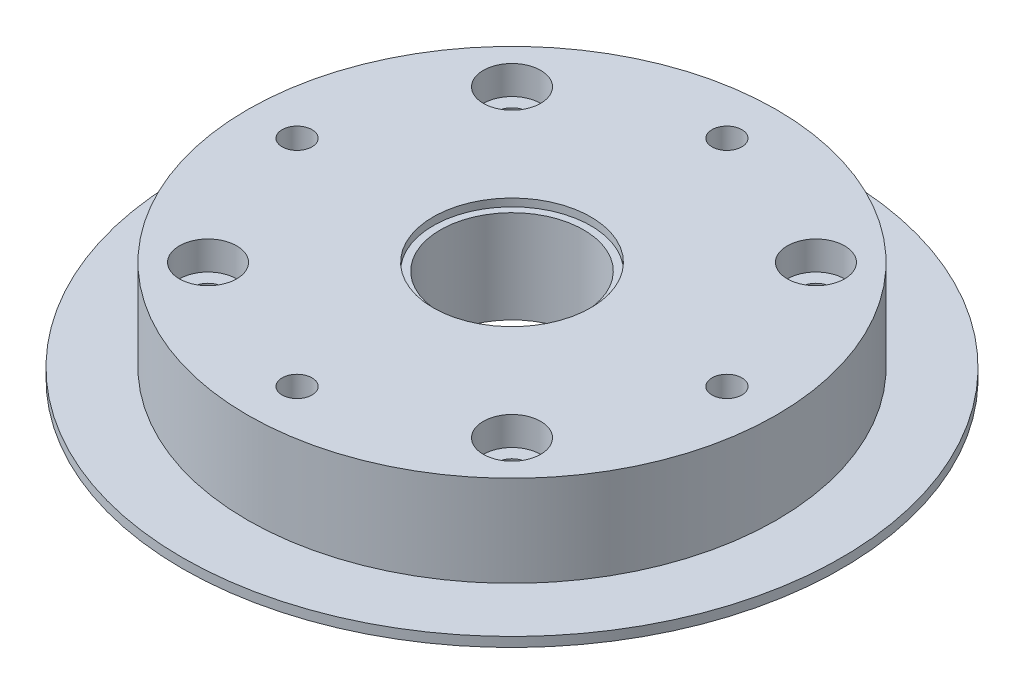
from build123d import *

# Parameters (mm, degrees)
SKETCH1_R           = 34.5
SKETCH1_R_2         = 1.5635
SKETCH1_R_3         = 7.5
BOSS_EXTRUDE1_DEPTH = 1
BOSS_EXTRUDE2_START = 9.525
SKETCH1_3_R         = 27.69
SKETCH1_3_R_2       = 7.5
SKETCH1_3_R_3       = 1.5635
BOSS_EXTRUDE2_DEPTH = 9.525
SKETCH2_R           = 3
SKETCH2_R_2         = 1.5635
CUT_EXTRUDE1_DEPTH  = 3
SKETCH3_R           = 1.925
CUT_EXTRUDE2_DEPTH  = 4
CUT_EXTRUDE3_START  = 9.525
SKETCH1_6_R         = 8.25
SKETCH1_6_R_2       = 7.5
CUT_EXTRUDE3_DEPTH  = 0.8


with BuildPart() as part:
    # Sketch1 → Boss-Extrude1 (new body)
    with BuildSketch(Plane(origin=(0, 0, 0), x_dir=(1, 0, 0), z_dir=(0, 1, 0))):
        Circle(SKETCH1_R)
        with Locations((22.5, 0)):
            Circle(SKETCH1_R_2, mode=Mode.SUBTRACT)
        with Locations((-15.909902577, -15.909902577)):
            Circle(SKETCH1_R_2, mode=Mode.SUBTRACT)
        with Locations((0, -22.5)):
            Circle(SKETCH1_R_2, mode=Mode.SUBTRACT)
        with Locations((15.909902577, -15.909902577)):
            Circle(SKETCH1_R_2, mode=Mode.SUBTRACT)
        with Locations((-22.5, 0)):
            Circle(SKETCH1_R_2, mode=Mode.SUBTRACT)
        with Locations((-15.909902577, 15.909902577)):
            Circle(SKETCH1_R_2, mode=Mode.SUBTRACT)
        with Locations((0, 22.5)):
            Circle(SKETCH1_R_2, mode=Mode.SUBTRACT)
        with Locations((15.909902577, 15.909902577)):
            Circle(SKETCH1_R_2, mode=Mode.SUBTRACT)
        Circle(SKETCH1_R_3, mode=Mode.SUBTRACT)
    extrude(amount=-BOSS_EXTRUDE1_DEPTH)

    # Sketch1<3> → Boss-Extrude2 (add)
    with BuildSketch(Plane(origin=(0, 0, 0), x_dir=(1, 0, 0), z_dir=(0, 1, 0)).offset(BOSS_EXTRUDE2_START)):
        Circle(SKETCH1_3_R)
        Circle(SKETCH1_3_R_2, mode=Mode.SUBTRACT)
        with Locations((-15.909902577, -15.909902577)):
            Circle(SKETCH1_3_R_3, mode=Mode.SUBTRACT)
        with Locations((0, -22.5)):
            Circle(SKETCH1_3_R_3, mode=Mode.SUBTRACT)
        with Locations((15.909902577, -15.909902577)):
            Circle(SKETCH1_3_R_3, mode=Mode.SUBTRACT)
        with Locations((-22.5, 0)):
            Circle(SKETCH1_3_R_3, mode=Mode.SUBTRACT)
        with Locations((-15.909902577, 15.909902577)):
            Circle(SKETCH1_3_R_3, mode=Mode.SUBTRACT)
        with Locations((0, 22.5)):
            Circle(SKETCH1_3_R_3, mode=Mode.SUBTRACT)
        with Locations((22.5, 0)):
            Circle(SKETCH1_3_R_3, mode=Mode.SUBTRACT)
        with Locations((15.909902577, 15.909902577)):
            Circle(SKETCH1_3_R_3, mode=Mode.SUBTRACT)
    extrude(amount=-BOSS_EXTRUDE2_DEPTH)

    # Sketch2 → Cut-Extrude1 (cut)
    # profile 1 of 4: a face of its own
    with BuildSketch(Plane(origin=(0, 9.525, 0), x_dir=(1, 0, 0), z_dir=(0, 1, 0))):
        with Locations((15.909902577, 15.909902577)):
            Circle(SKETCH2_R)
        with Locations((15.909902577, 15.909902577)):
            Circle(SKETCH2_R_2, mode=Mode.SUBTRACT)
    # profile 2 of 4: a face of its own
    with BuildSketch(Plane(origin=(0, 9.525, 0), x_dir=(1, 0, 0), z_dir=(0, 1, 0))):
        with Locations((15.909902577, -15.909902577)):
            Circle(SKETCH2_R)
    # profile 3 of 4: a face of its own
    with BuildSketch(Plane(origin=(0, 9.525, 0), x_dir=(1, 0, 0), z_dir=(0, 1, 0))):
        with Locations((-15.909902577, -15.909902577)):
            Circle(SKETCH2_R)
        with Locations((-15.909902577, -15.909902577)):
            Circle(SKETCH2_R_2, mode=Mode.SUBTRACT)
    # profile 4 of 4: a face of its own
    with BuildSketch(Plane(origin=(0, 9.525, 0), x_dir=(1, 0, 0), z_dir=(0, 1, 0))):
        with Locations((-15.909902577, 15.909902577)):
            Circle(SKETCH2_R)
        with Locations((-15.909902577, 15.909902577)):
            Circle(SKETCH2_R_2, mode=Mode.SUBTRACT)
    extrude(amount=-CUT_EXTRUDE1_DEPTH, mode=Mode.SUBTRACT)

    # Sketch3 → Cut-Extrude2 (cut)
    with BuildSketch(Plane.XZ.offset(1)):
        with Locations((22.5, 0)):
            Circle(SKETCH3_R)
        with Locations((0, -22.5)):
            Circle(SKETCH3_R)
        with Locations((-22.5, 0)):
            Circle(SKETCH3_R)
        with Locations((0, 22.5)):
            Circle(SKETCH3_R)
    extrude(amount=-CUT_EXTRUDE2_DEPTH, mode=Mode.SUBTRACT)

    # Sketch1<6> → Cut-Extrude3 (cut)
    with BuildSketch(Plane(origin=(0, 0, 0), x_dir=(1, 0, 0), z_dir=(0, 1, 0)).offset(CUT_EXTRUDE3_START)):
        Circle(SKETCH1_6_R)
        Circle(SKETCH1_6_R_2, mode=Mode.SUBTRACT)
    extrude(amount=-CUT_EXTRUDE3_DEPTH, mode=Mode.SUBTRACT)


solid = part.part
